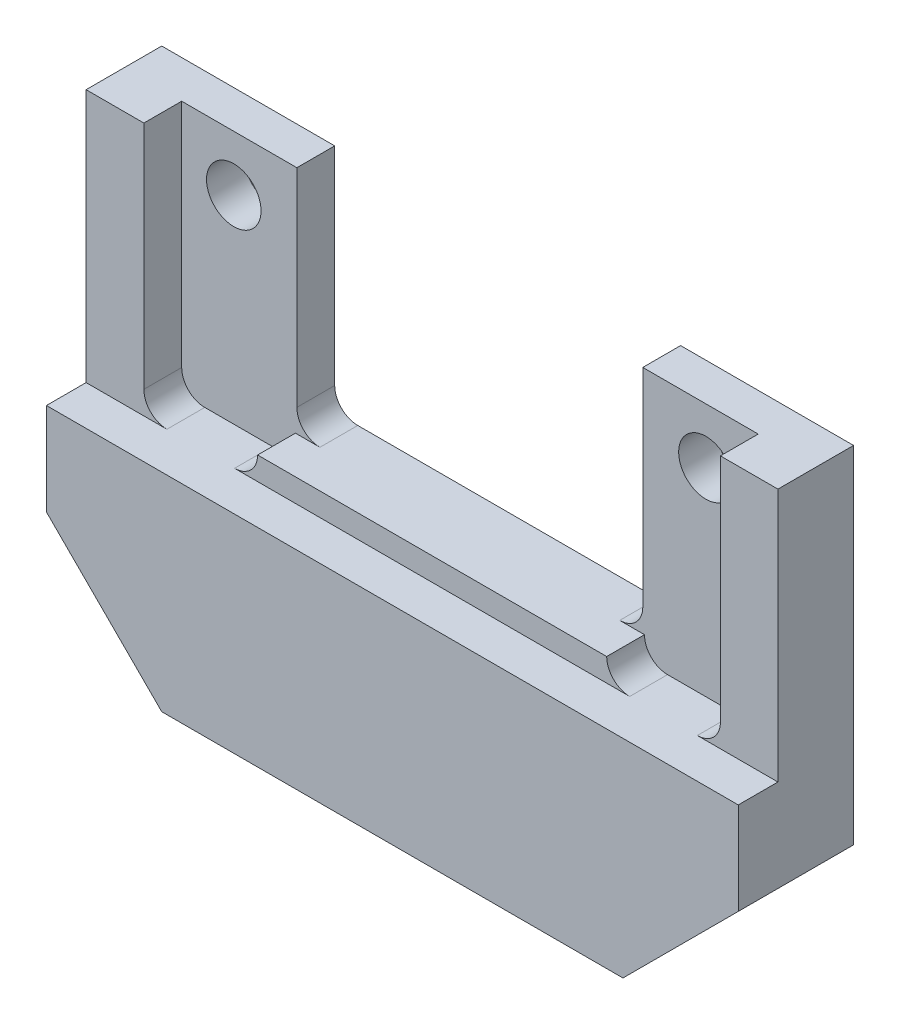
from build123d import *

# Parameters (mm, degrees)
SKETCH1_W                       = 38.1
SKETCH1_H                       = 25.4
BOSS_EXTRUDE1_DEPTH             = 6.35
SKETCH3_W                       = 38.1
SKETCH3_H                       = 13.97
CUT_EXTRUDE1_DEPTH              = 2.1844
SKETCH4_R                       = 1.27
CUT_EXTRUDE2_DEPTH              = 24.271113496
SKETCH6_W                       = 19.05
SKETCH6_H                       = 19.05
CUT_EXTRUDE5_DEPTH              = 24.759524406
SKETCH7_W                       = 31.75
SKETCH7_H                       = 2.0828
CUT_EXTRUDE6_DEPTH              = 12.7
CUT_EXTRUDE9_REACH              = 25.271
SKETCH10_R                      = 1.5
SKETCH15_W                      = 6.263340786
SKETCH15_H                      = 2.0828
CUT_EXTRUDE14_DEPTH             = 1.27
FILLET7_R                       = 1.27
CHAMFER10_SIZE                  = 6.35
F_8_32_TAPPED_HOLE2_D           = 3.4544
F_8_32_TAPPED_HOLE2_DEPTH       = 6.35
F_8_32_TAPPED_HOLE2_CSINK_D     = 5.08
F_8_32_TAPPED_HOLE2_CSINK_ANGLE = 90
F_8_32_TAPPED_HOLE2_TIP         = 1.037806461
F_8_32_TAPPED_HOLE3_D           = 3.4544
F_8_32_TAPPED_HOLE3_DEPTH       = 6.35
F_8_32_TAPPED_HOLE3_CSINK_D     = 5.08
F_8_32_TAPPED_HOLE3_CSINK_ANGLE = 90
F_8_32_TAPPED_HOLE3_TIP         = 1.037806461


with BuildPart() as part:
    # Sketch1 → Boss-Extrude1 (new body)
    with BuildSketch(Plane.XY):
        Rectangle(SKETCH1_W, SKETCH1_H)
    extrude(amount=-BOSS_EXTRUDE1_DEPTH)

    # Sketch3 → Cut-Extrude1 (cut)
    with BuildSketch(Plane.XY):
        with Locations((0, 5.715)):
            Rectangle(SKETCH3_W, SKETCH3_H)
    extrude(amount=-CUT_EXTRUDE1_DEPTH, mode=Mode.SUBTRACT)

    # Sketch4 → Cut-Extrude2 (cut, through all)
    with BuildSketch(Plane.XY.offset(-2.1844)):
        with Locations((-13, 9.652)):
            Circle(SKETCH4_R)
        with Locations(Location((13, 9.652, 0), (0, 0, 180))):
            Circle(SKETCH4_R)
    extrude(amount=-CUT_EXTRUDE2_DEPTH, mode=Mode.SUBTRACT)

    # Sketch6 → Cut-Extrude5 (cut, through all)
    with BuildSketch(Plane.XY):
        with Locations((0, 9.525)):
            Rectangle(SKETCH6_W, SKETCH6_H)
    extrude(amount=-CUT_EXTRUDE5_DEPTH, mode=Mode.SUBTRACT)

    # Sketch7 → Cut-Extrude6 (cut)
    with BuildSketch(Plane(origin=(0, 12.7, 0), x_dir=(1, 0, 0), z_dir=(0, 1, 0))):
        with Locations((0.006850314, 3.2258)):
            Rectangle(SKETCH7_W, SKETCH7_H)
    extrude(amount=-CUT_EXTRUDE6_DEPTH, mode=Mode.SUBTRACT)

    # Sketch10 → Cut-Extrude9 (cut, up to next)
    with BuildSketch(Plane.XY.offset(-2.1844), mode=Mode.PRIVATE) as cut_extrude9_sk1:
        with Locations((-13, 9.652)):
            Circle(SKETCH10_R)
    cut_extrude9_tool1 = extrude(cut_extrude9_sk1.sketch, amount=-CUT_EXTRUDE9_REACH, mode=Mode.PRIVATE) & part.part
    # Sketch10 → Cut-Extrude9 (cut, up to next)
    with BuildSketch(Plane.XY.offset(-2.1844), mode=Mode.PRIVATE) as cut_extrude9_sk2:
        with Locations((13, 9.652)):
            Circle(SKETCH10_R)
    cut_extrude9_tool2 = extrude(cut_extrude9_sk2.sketch, amount=-CUT_EXTRUDE9_REACH, mode=Mode.PRIVATE) & part.part
    add(cut_extrude9_tool1.solids().sort_by_distance((-13, 9.652, -2.1844))[0], mode=Mode.SUBTRACT)
    add(cut_extrude9_tool2.solids().sort_by_distance((13, 9.652, -2.1844))[0], mode=Mode.SUBTRACT)

    # Sketch15 → Cut-Extrude14 (cut)
    with BuildSketch(Plane(origin=(0, 0, 0), x_dir=(1, 0, 0), z_dir=(0, 1, 0))):
        with Locations((-12.736479293, 3.2258)):
            Rectangle(SKETCH15_W, SKETCH15_H)
        with Locations((12.750179921, 3.2258)):
            Rectangle(SKETCH15_W, SKETCH15_H)
    extrude(amount=-CUT_EXTRUDE14_DEPTH, mode=Mode.SUBTRACT)

    # Fillet7
    fillet7_edges = [part.edges().sort_by_distance(p)[0] for p in [
        (15.881850314, -1.27, -3.2258),
        (-15.868149686, -1.27, -3.2258),
        (-9.525, 0, -5.3086),
        (9.525, 0, -5.3086),
        (-9.6048089, -1.27, -3.2258),
        (9.618509528, -1.27, -3.2258),
    ]]
    fillet(fillet7_edges, radius=FILLET7_R - 0.0001)  # a hair under: the kernel refuses the full size

    # Chamfer10
    chamfer10_edges = [part.edges().sort_by_distance(p)[0] for p in [
        (19.05, -12.7, -3.175),
        (-19.05, -12.7, -3.175),
    ]]
    chamfer(chamfer10_edges, length=CHAMFER10_SIZE)

    # #8-32 Tapped Hole2
    with Locations(Plane(origin=(-12.7, -12.7, 0), x_dir=(-0.7071067811865487, 0.7071067811865465, 0), z_dir=(-0.7071067811865465, -0.7071067811865487, 0))):
        with Locations((4.490128061, 3.175)):
            CounterSinkHole(F_8_32_TAPPED_HOLE2_D / 2, F_8_32_TAPPED_HOLE2_CSINK_D / 2, depth=F_8_32_TAPPED_HOLE2_DEPTH, counter_sink_angle=F_8_32_TAPPED_HOLE2_CSINK_ANGLE)
            with Locations((0, 0, -(F_8_32_TAPPED_HOLE2_DEPTH + F_8_32_TAPPED_HOLE2_TIP / 2))):  # 118° drill point
                Cone(0, F_8_32_TAPPED_HOLE2_D / 2, F_8_32_TAPPED_HOLE2_TIP, mode=Mode.SUBTRACT)

    # #8-32 Tapped Hole3
    with Locations(Plane(origin=(12.7, -12.7, 0), x_dir=(0, 0, -1), z_dir=(0.707106781186549, -0.7071067811865461, 0))):
        with Locations((3.175, 4.490128061)):
            CounterSinkHole(F_8_32_TAPPED_HOLE3_D / 2, F_8_32_TAPPED_HOLE3_CSINK_D / 2, depth=F_8_32_TAPPED_HOLE3_DEPTH, counter_sink_angle=F_8_32_TAPPED_HOLE3_CSINK_ANGLE)
            with Locations((0, 0, -(F_8_32_TAPPED_HOLE3_DEPTH + F_8_32_TAPPED_HOLE3_TIP / 2))):  # 118° drill point
                Cone(0, F_8_32_TAPPED_HOLE3_D / 2, F_8_32_TAPPED_HOLE3_TIP, mode=Mode.SUBTRACT)


solid = part.part
